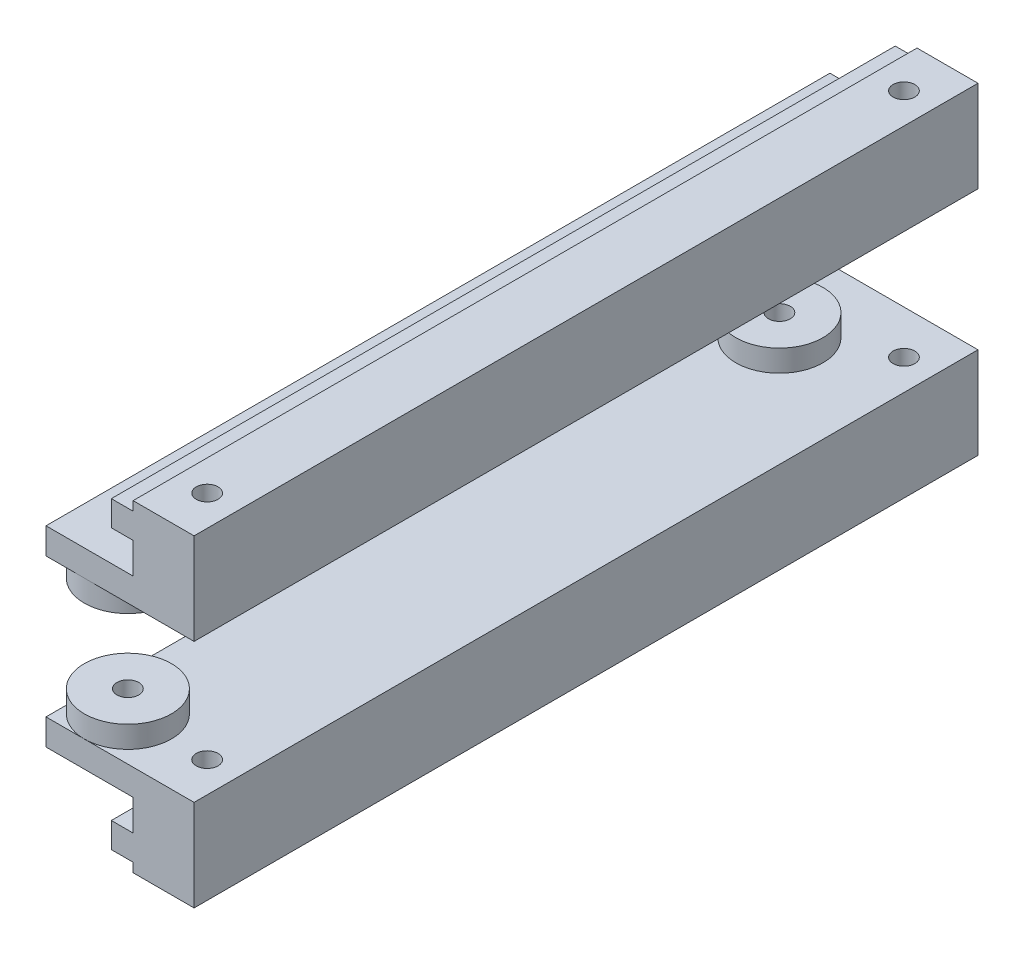
from build123d import *

# Parameters (mm, degrees)
MAIN_DEPTH         = 90
SKETCH2_R          = 5
PLOT_DEPTH         = 2.5
SKETCH3_R          = 1.25
HOLEFIX_DEPTH      = 92.549767886
SKETCH4_R          = 1.25
CUT_EXTRUDE4_DEPTH = 93.621595754


with BuildPart() as part:
    # Sketch1 → Main (new body)
    with BuildSketch(Plane.XY):
        Polygon((-10, 7.5), (0, 7.5), (0, 3.95), (-2.5, 3.95), (-2.5, 1.05), (0, 1.05), (0, 0), (7, 0), (7, 10.5), (-10, 10.5), align=None)
    extrude(amount=MAIN_DEPTH)

    # Sketch2 → Plot (add)
    with BuildSketch(Plane(origin=(0, 10.5, 0), x_dir=(1, 0, 0), z_dir=(0, 1, 0))):
        with Locations((-5.6, -85)):
            Circle(SKETCH2_R)
        with Locations((-5.6, -10.2)):
            Circle(SKETCH2_R)
    extrude(amount=PLOT_DEPTH)

    # Sketch3 → HoleFix (cut, through all)
    with BuildSketch(Plane(origin=(0, 13, 0), x_dir=(1, 0, 0), z_dir=(0, 1, 0))):
        with Locations((-5.6, -10.2)):
            Circle(SKETCH3_R)
        with Locations((-5.6, -85)):
            Circle(SKETCH3_R)
    extrude(amount=-HOLEFIX_DEPTH, mode=Mode.SUBTRACT)

    # Sketch4 → Cut-Extrude4 (cut, through all)
    with BuildSketch(Plane(origin=(7, 0, 0), x_dir=(0, 0, -1), z_dir=(0, 1, 0))):
        with Locations((-85, 3.5)):
            Circle(SKETCH4_R)
        with Locations((-5, 3.5)):
            Circle(SKETCH4_R)
    extrude(amount=CUT_EXTRUDE4_DEPTH, mode=Mode.SUBTRACT)


with BuildPart() as body_2:
    # Mirror2: mirrored copy
    add(part.part.mirror(Plane.ZX.offset(18.5)))


solid = Compound([part.part, body_2.part])
